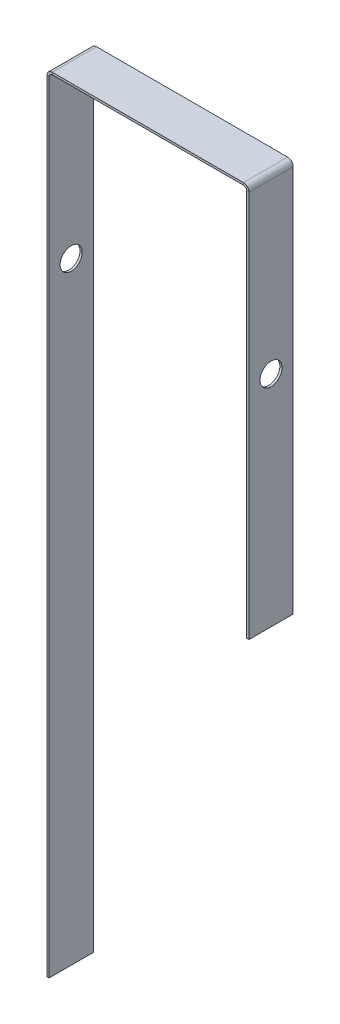
from build123d import *

# Parameters (mm, degrees)
BASE_FLANGE3_DEPTH = 10
SKETCH15_R         = 2.5
CUT_EXTRUDE1_DEPTH = 45.72


# Sheet-metal steps are written as plain solids
with BuildPart() as part:
    # Sketch12 → Base-Flange3 (new body)
    with BuildSketch(Plane.XY):
        with BuildLine():
            Line((-70.950809652, -37.371859757), (-70.950809652, 139.183540243))
            ThreePointArc((-70.950809652, 139.183540243), (-70.586274752, 140.063605343), (-69.706209652, 140.428140243))
            Line((-69.706209652, 140.428140243), (-26.475409652, 140.428140243))
            ThreePointArc((-26.475409652, 140.428140243), (-25.595344552, 140.063605343), (-25.230809652, 139.183540243))
            Line((-25.230809652, 139.183540243), (-25.230809652, 51.528140243))
            Line((-25.230809652, 51.528140243), (-25.738809652, 51.528140243))
            Line((-25.738809652, 51.528140243), (-25.738809652, 139.183540243))
            ThreePointArc((-25.738809652, 139.183540243), (-25.954554797, 139.704395098), (-26.475409652, 139.920140243))
            Line((-26.475409652, 139.920140243), (-69.706209652, 139.920140243))
            ThreePointArc((-69.706209652, 139.920140243), (-70.227064507, 139.704395098), (-70.442809652, 139.183540243))
            Line((-70.442809652, 139.183540243), (-70.442809652, -37.371859757))
            Line((-70.442809652, -37.371859757), (-70.950809652, -37.371859757))
        make_face()
    extrude(amount=BASE_FLANGE3_DEPTH)

    # Sketch15 → Cut-Extrude1 (cut)
    with BuildSketch(Plane.ZY.offset(70.950809652)):
        with Locations((5, 101.083540243)):
            Circle(SKETCH15_R)
    extrude(amount=-CUT_EXTRUDE1_DEPTH, mode=Mode.SUBTRACT)


solid = part.part
